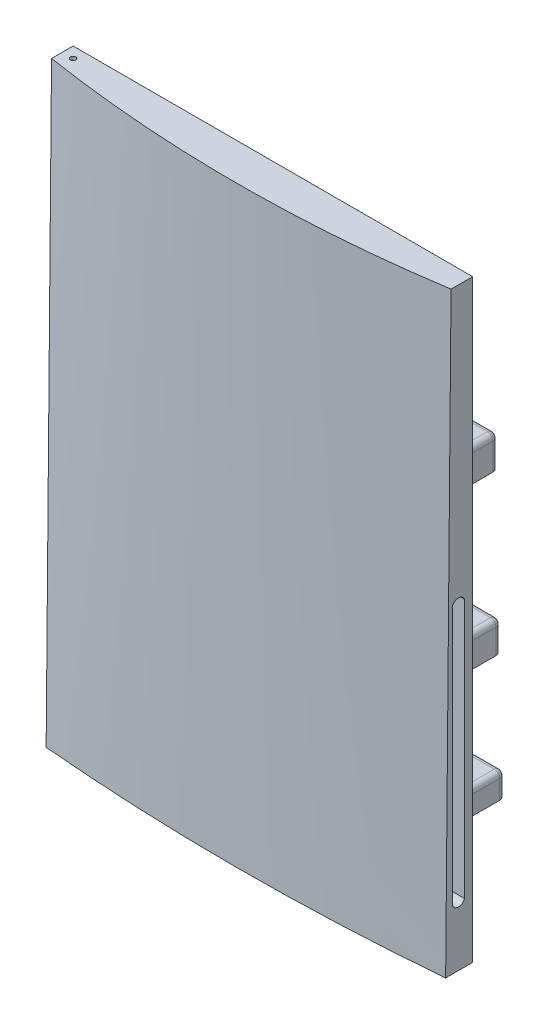
from build123d import *

# Parameters (mm, degrees)
CORTE_EXTRUS_O3_REACH     = 1164.591
ESBO_O5_R                 = 5
CORTE_EXTRUS_O4_DEPTH     = 10
ESBO_O8_W                 = 680
ESBO_O8_H                 = 1040
RESSALTO_EXTRUS_O1_DEPTH  = 20
FILETE1_R                 = 10
ESBO_O11_W                = 22.5
ESBO_O11_H                = 480
CORTE_EXTRUS_O5_DEPTH     = 35
CORTE_EXTRUS_O6_DEPTH     = 35
FILETE15_R                = 10
RESSALTO_EXTRUS_O2_DEPTH  = 120
FILETE16_R                = 10
RESSALTO_EXTRUS_O4_DEPTH  = 120
ESBO_O16_W                = 319.937855213
ESBO_O16_H                = 10
RESSALTO_EXTRUS_O5_DEPTH  = 36.138
FILETE17_R                = 10
RESSALTO_EXTRUS_O6_DEPTH  = 120
ESBO_O18_W                = 162.736994832
ESBO_O18_H                = 10
RESSALTO_EXTRUS_O7_DEPTH  = 46.138
FILETE18_R                = 10
ESBO_O19_W                = 531.126065259
ESBO_O19_H                = 10
RESSALTO_EXTRUS_O8_DEPTH  = 120
RESSALTO_EXTRUS_O9_DEPTH  = 50
FILETE19_R                = 10
ESBO_O22_W                = 529.518507703
ESBO_O22_H                = 10
RESSALTO_EXTRUS_O10_DEPTH = 35


with BuildPart() as part:
    # Esboço2 for Loft1 → Loft1 section 0
    with BuildSketch(Plane(origin=(0, 1100, 0), x_dir=(1, 0, 0), z_dir=(0, 1, 0))):
        with BuildLine():
            Line((-370, 0), (370, 0))
            Line((370, 0), (370, -40))
            # circular arc as an exact rational Bezier (weights 1, cos(half-angle), 1)
            Bezier((370, -40), (0, -97.731859317), (-370, -40), weights=[1, 0.988044857, 1])
            Line((-370, -40), (-370, 0))
        make_face()
    # Esboço1 for Loft1 → Loft1 section 1
    with BuildSketch(Plane(origin=(0, 0, 0), x_dir=(1, 0, 0), z_dir=(0, 1, 0))):
        with BuildLine():
            Line((-370, 0), (370, 0))
            Line((370, 0), (370, -50))
            Bezier((370, -50), (0, -82.722461177), (-370, -50), weights=[1, 0.996112056, 1])
            Line((-370, -50), (-370, 0))
        make_face()
    loft()

    # Esboço5 → Corte-extrusão3 (cut, up to next)
    with BuildSketch(Plane.XZ, mode=Mode.PRIVATE) as corte_extrus_o3_sk1:
        with Locations(Location((-350, 20, 0), (0, 0, 270))):
            Circle(ESBO_O5_R)
    corte_extrus_o3_tool1 = extrude(corte_extrus_o3_sk1.sketch, amount=-CORTE_EXTRUS_O3_REACH, mode=Mode.PRIVATE) & part.part
    add(corte_extrus_o3_tool1.solids().sort_by_distance((-350, 0, 20))[0], mode=Mode.SUBTRACT)

    # Esboço6 → Corte-extrusão4 (cut)
    with BuildSketch(Plane.XZ):
        with BuildLine():
            Line((-370, 0), (-320.856761827, 0))
            Line((-320.856761827, 0), (-320.856761827, 10.441916975))
            ThreePointArc((-320.856761827, 10.441916975), (-325.250160109, 21.048518693), (-335.856761827, 25.441916975))
            Line((-335.856761827, 25.441916975), (-370, 25.441916975))
            Line((-370, 25.441916975), (-370, 0))
        make_face()
    extrude(amount=-CORTE_EXTRUS_O4_DEPTH, mode=Mode.SUBTRACT)

    # Esboço8 → Ressalto-extrusão1 (add)
    with BuildSketch(Plane(origin=(0, 0, 0), x_dir=(-1, 0, 0), z_dir=(0, 0, -1))):
        with Locations((-5, 555)):
            Rectangle(ESBO_O8_W, ESBO_O8_H)
    extrude(amount=RESSALTO_EXTRUS_O1_DEPTH)

    # Filete1
    filete1_edges = [part.edges().sort_by_distance(p)[0] for p in [
        (-335, 555, 0),
        (-335, 35, -10),
        (5, 1075, 0),
        (-335, 1075, -10),
        (345, 555, 0),
        (345, 1075, -10),
        (5, 35, 0),
        (345, 35, -10),
        (-335, 555, -20),
        (345, 555, -20),
        (5, 35, -20),
    ]]
    fillet(filete1_edges, radius=FILETE1_R - 0.0001)  # a hair under: the kernel refuses the full size

    # Esboço11 → Corte-extrusão5 (cut)
    with BuildSketch(Plane(origin=(370, 0, 0), x_dir=(0, 0, -1), z_dir=(1, 0, 0))):
        with Locations((-26.25, 350)):
            Rectangle(ESBO_O11_W, ESBO_O11_H)
    extrude(amount=-CORTE_EXTRUS_O5_DEPTH, mode=Mode.SUBTRACT)

    # Esboço12 → Corte-extrusão6 (cut)
    with BuildSketch(Plane(origin=(370, 0, 0), x_dir=(0, 0, -1), z_dir=(1, 0, 0))):
        with BuildLine():
            Line((-15, 110), (-37.5, 110))
            ThreePointArc((-37.5, 110), (-26.25, 102.175823272), (-15, 110))
        make_face()
        with BuildLine():
            Line((-15, 590), (-37.5, 590))
            ThreePointArc((-37.5, 590), (-26.25, 597.824176728), (-15, 590))
        make_face()
    extrude(amount=-CORTE_EXTRUS_O6_DEPTH, mode=Mode.SUBTRACT)

    # Filete15
    filete15_edges = [part.edges().sort_by_distance(p)[0] for p in [
        (335, 350, 37.5),
    ]]
    fillet(filete15_edges, radius=FILETE15_R)

    # Esboço13 → Ressalto-extrusão2 (add)
    with BuildSketch(Plane(origin=(0, 0, -20), x_dir=(-1, 0, 0), z_dir=(0, 0, -1))):
        Polygon((260, 155), (250, 155), (250, 190), (-280, 190), (-280, 155), (-290, 155), (-290, 200), (260, 200), align=None)
    extrude(amount=RESSALTO_EXTRUS_O2_DEPTH)

    # Filete16
    filete16_edges = [part.edges().sort_by_distance(p)[0] for p in [
        (290, 200, -80),
        (-260, 200, -80),
        (15, 200, -140),
        (-260, 177.5, -140),
        (290, 177.5, -140),
    ]]
    fillet(filete16_edges, radius=FILETE16_R - 0.0001)  # a hair under: the kernel refuses the full size

    # Esboço15 → Ressalto-extrusão4 (add)
    with BuildSketch(Plane(origin=(0, 0, -20), x_dir=(-1, 0, 0), z_dir=(0, 0, -1))):
        Polygon((253.776635588, 383.41937577), (243.776635588, 383.41937577), (243.776635588, 419.557368326), (-76.161219625, 419.557368326), (-76.161219625, 383.41937577), (-86.161219625, 383.41937577), (-86.161219625, 429.557368326), (253.776635588, 429.557368326), align=None)
    extrude(amount=RESSALTO_EXTRUS_O4_DEPTH)

    # Esboço16 → Ressalto-extrusão5 (add)
    with BuildSketch(Plane.XZ.offset(-419.557368326)):
        with Locations((-83.807707982, -135)):
            Rectangle(ESBO_O16_W, ESBO_O16_H)
    extrude(amount=RESSALTO_EXTRUS_O5_DEPTH)

    # Filete17
    filete17_edges = [part.edges().sort_by_distance(p)[0] for p in [
        (-253.776635588, 429.557368326, -80),
        (86.161219625, 429.557368326, -80),
        (-253.776635588, 406.488372048, -140),
        (-83.807707982, 429.557368326, -140),
        (86.161219625, 406.488372048, -140),
    ]]
    fillet(filete17_edges, radius=FILETE17_R - 0.0001)  # a hair under: the kernel refuses the full size

    # Esboço17 → Ressalto-extrusão6 (add)
    with BuildSketch(Plane(origin=(0, 0, -20), x_dir=(-1, 0, 0), z_dir=(0, 0, -1))):
        Polygon((-100.263005168, 439.557368326), (-283, 439.557368326), (-283, 383.41937577), (-273, 383.41937577), (-273, 429.557368326), (-110.263005168, 429.557368326), (-110.263005168, 383.41937577), (-100.263005168, 383.41937577), align=None)
    extrude(amount=RESSALTO_EXTRUS_O6_DEPTH)

    # Esboço18 → Ressalto-extrusão7 (add)
    with BuildSketch(Plane(origin=(0, 429.557368326, 0), x_dir=(-1, 0, 0), z_dir=(0, -1, 0))):
        with Locations((-191.631502584, 135)):
            Rectangle(ESBO_O18_W, ESBO_O18_H)
    extrude(amount=RESSALTO_EXTRUS_O7_DEPTH)

    # Filete18
    filete18_edges = [part.edges().sort_by_distance(p)[0] for p in [
        (100.263005168, 439.557368326, -80),
        (283, 439.557368326, -80),
        (100.263005168, 411.488372048, -140),
        (191.631502584, 439.557368326, -140),
        (283, 411.488372048, -140),
    ]]
    fillet(filete18_edges, radius=FILETE18_R - 0.0001)  # a hair under: the kernel refuses the full size

    # Esboço19 → Ressalto-extrusão8 (add)
    with BuildSketch(Plane(origin=(0, 0, -20), x_dir=(-1, 0, 0), z_dir=(0, 0, -1))):
        with Locations((-11.786397041, 730)):
            Rectangle(ESBO_O19_W, ESBO_O19_H)
    extrude(amount=RESSALTO_EXTRUS_O8_DEPTH)

    # Esboço20 → Ressalto-extrusão9 (add)
    with BuildSketch(Plane.XZ.offset(-725)):
        Polygon((-253.776635588, -20), (-253.776635588, -140), (277.349429671, -140), (277.349429671, -20), (267.349429671, -20), (267.349429671, -130), (-243.776635588, -130), (-243.776635588, -20), align=None)
    extrude(amount=RESSALTO_EXTRUS_O9_DEPTH)

    # Filete19
    filete19_edges = [part.edges().sort_by_distance(p)[0] for p in [
        (277.349429671, 735, -80),
        (-253.776635588, 735, -80),
        (277.349429671, 705, -140),
        (-253.776635588, 705, -140),
        (11.786397041, 735, -140),
    ]]
    fillet(filete19_edges, radius=FILETE19_R)

    # Esboço22 → Ressalto-extrusão10 (add)
    with BuildSketch(Plane.XZ.offset(-190)):
        with Locations((14.759253851, -135)):
            Rectangle(ESBO_O22_W, ESBO_O22_H)
    extrude(amount=RESSALTO_EXTRUS_O10_DEPTH)


solid = part.part
